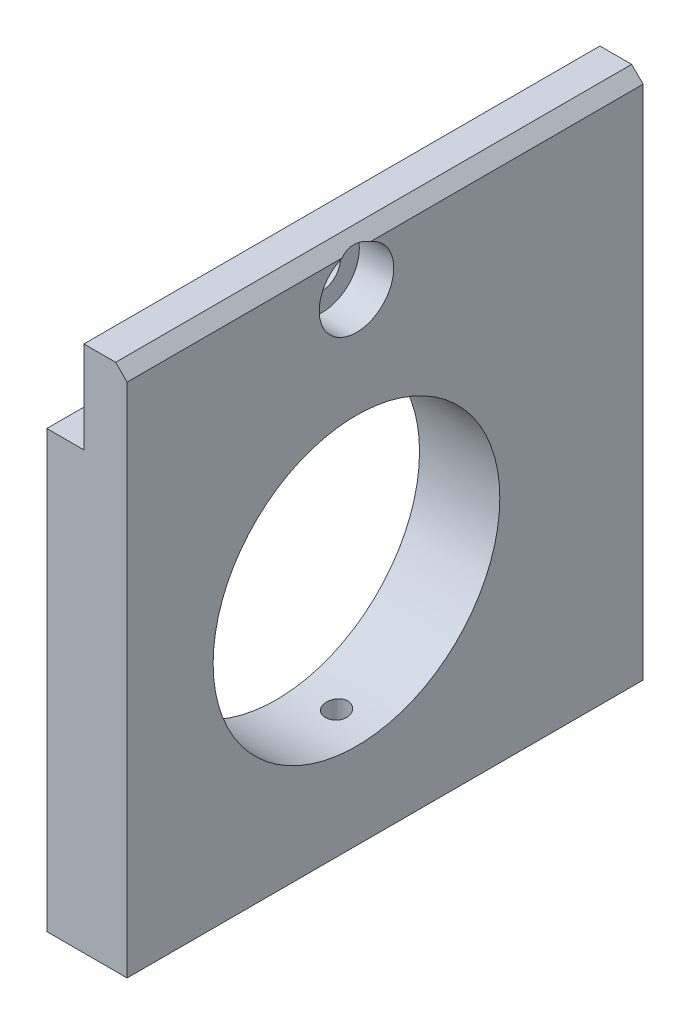
from build123d import *

# Parameters (mm, degrees)
BOSS_EXTRUDE1_DEPTH            = 45
CBORE_FOR_M3_SHCS1_D           = 3.2
CBORE_FOR_M3_SHCS1_CBORE_D     = 6.5
CBORE_FOR_M3_SHCS1_CBORE_DEPTH = 3
F_25_0_25_DIAMETER_HOLE1_D     = 25
CHAMFER1_SIZE                  = 1
F_3_0MM_DOWEL_HOLE1_D          = 3
F_3_0MM_DOWEL_HOLE1_DEPTH      = 4.5
F_3_0MM_DOWEL_HOLE1_TIP        = 0.901290929
M3X0_5_TAPPED_HOLE1_D          = 2.5
M3X0_5_TAPPED_HOLE1_DEPTH      = 7.5
M3X0_5_TAPPED_HOLE1_TIP        = 0.751075774


with BuildPart() as part:
    # Sketch1 → Boss-Extrude1 (new body)
    with BuildSketch(Plane.XY):
        Polygon((3.23, 30.362745098), (3.23, 22.362745098), (0, 22.362745098), (0, -15.637254902), (7, -15.637254902), (7, 30.362745098), align=None)
    extrude(amount=BOSS_EXTRUDE1_DEPTH)

    # CBORE for M3 SHCS1 (through all)
    with Locations(Plane(origin=(7, 0, 0), x_dir=(0, 0, -1), z_dir=(1, 0, 0))):
        with Locations((-25, 26.362745098)):
            CounterBoreHole(CBORE_FOR_M3_SHCS1_D / 2, CBORE_FOR_M3_SHCS1_CBORE_D / 2, CBORE_FOR_M3_SHCS1_CBORE_DEPTH)

    # Ø25.0 (25) Diameter Hole1 (through all)
    with Locations(Plane(origin=(7, 0, 0), x_dir=(0, 0, -1), z_dir=(1, 0, 0))):
        with Locations((-25, 4.362745098)):
            Hole(F_25_0_25_DIAMETER_HOLE1_D / 2)

    # Chamfer1
    # the kernel refuses this chamfer: 1 mm, written as the material it takes off along each edge
    with BuildSketch(Plane(origin=(7, 30.362745098, -2.571682988), x_dir=(-0.9996219169112968, 0.027495876610585623, 0), z_dir=(0, 0, 1))) as chamfer1_piece_1:
        Polygon((CHAMFER1_SIZE * 0.999621916911, CHAMFER1_SIZE * 0.0274958766106), (-CHAMFER1_SIZE * 0.0274958766106, CHAMFER1_SIZE * 0.999621916911), (0, 0), align=None)
    extrude(amount=50.143365976, mode=Mode.SUBTRACT)

    # Ø3.0mm Dowel Hole1
    with Locations(Plane(origin=(0, -15.637254902, 0), x_dir=(-1, 0, 0), z_dir=(0, -1, 0))):
        with Locations((-3.5, -38), (-3.5, -7)):
            Hole(F_3_0MM_DOWEL_HOLE1_D / 2, depth=F_3_0MM_DOWEL_HOLE1_DEPTH)
            with Locations((0, 0, -(F_3_0MM_DOWEL_HOLE1_DEPTH + F_3_0MM_DOWEL_HOLE1_TIP / 2))):  # 118° drill point
                Cone(0, F_3_0MM_DOWEL_HOLE1_D / 2, F_3_0MM_DOWEL_HOLE1_TIP, mode=Mode.SUBTRACT)

    # M3x0.5 Tapped Hole1
    with Locations(Plane(origin=(0, -15.637254902, 0), x_dir=(-1, 0, 0), z_dir=(0, -1, 0))):
        with Locations((-3.5, -23)):
            Hole(M3X0_5_TAPPED_HOLE1_D / 2, depth=M3X0_5_TAPPED_HOLE1_DEPTH)
            with Locations((0, 0, -(M3X0_5_TAPPED_HOLE1_DEPTH + M3X0_5_TAPPED_HOLE1_TIP / 2))):  # 118° drill point
                Cone(0, M3X0_5_TAPPED_HOLE1_D / 2, M3X0_5_TAPPED_HOLE1_TIP, mode=Mode.SUBTRACT)


solid = part.part
